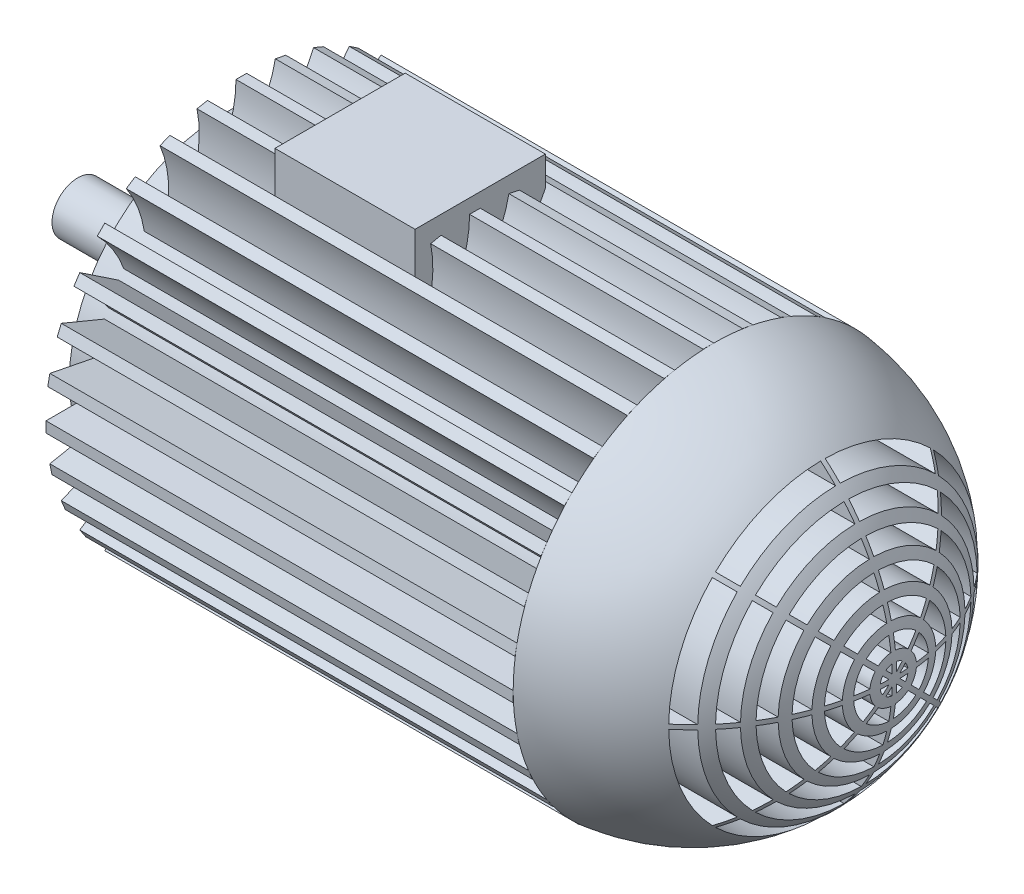
from build123d import *
from build123d.topology import SkipClean

# Parameters (mm, degrees)
BOSS_EXTRUDE1_DEPTH = 200
CIRPATTERN1_COUNT   = 32
BOSS_EXTRUDE2_START = 10
SKETCH3_R           = 65.881435925
BOSS_EXTRUDE2_DEPTH = 10
SKETCH4_R           = 11
BOSS_EXTRUDE3_DEPTH = 30
SKETCH5_R           = 5
CUT_EXTRUDE1_DEPTH  = 5
CIRPATTERN2_COUNT   = 8
SKETCH6_R           = 4
CUT_EXTRUDE2_DEPTH  = 240
SKETCH7_W           = 55.76744746
SKETCH7_H           = 35.817691574
BOSS_EXTRUDE4_DEPTH = 60
CUT_EXTRUDE6_DEPTH  = 80
SCALE1_SCALE        = 0.8
SKETCH12_R          = 8.8
SKETCH12_R_2        = 3.2
BOSS_EXTRUDE7_DEPTH = 25.84


with BuildPart() as part:
    # Sketch1 → Revolve1 (revolve)
    with BuildSketch(Plane.XY):
        with BuildLine():
            Line((0, 0), (277.354361283, 0))
            ThreePointArc((277.354361283, 0), (255.164754533, 57.791258522), (200, 85.881435925))
            Line((200, 85.881435925), (200, 65.881435925))
            Line((200, 65.881435925), (0, 65.881435925))
            Line((0, 65.881435925), (0, 0))
        make_face()
    revolve(axis=Axis((0, 0, 0), (1, 0, 0)))

    # Sketch2 → Boss-Extrude1 (add)
    with BuildSketch(Plane.ZY):
        with BuildLine():
            Line((0, 85.881435925), (0, 65.881435925))
            ThreePointArc((0, 65.881435925), (4.544830399, 65.724486428), (9.068006478, 65.254385738))
            ThreePointArc((9.068006478, 65.254385738), (5.694165901, 75.32361746), (4.551932571, 85.881435925))
            Line((4.551932571, 85.881435925), (0, 85.881435925))
        make_face()
    boss_extrude1 = extrude(amount=-BOSS_EXTRUDE1_DEPTH)

    # CirPattern1: Boss-Extrude1 ×32 about axis
    cirpattern1_axis = Axis((0, 0, 0), (1, 0, 0))
    for i in range(1, CIRPATTERN1_COUNT):
        add(boss_extrude1.rotate(cirpattern1_axis, i * 360 / CIRPATTERN1_COUNT))

    # Sketch3 → Boss-Extrude2 (add)
    with SkipClean():  # the faces are left unmerged after this step: merging them gives an invalid solid
        with BuildSketch(Plane.ZY.offset(BOSS_EXTRUDE2_START)):
            Circle(SKETCH3_R)
        extrude(amount=-BOSS_EXTRUDE2_DEPTH)

    # Sketch4 → Boss-Extrude3 (add)
    with SkipClean():  # the faces are left unmerged after this step: merging them gives an invalid solid
        with BuildSketch(Plane.ZY.offset(10)):
            Circle(SKETCH4_R)
        extrude(amount=BOSS_EXTRUDE3_DEPTH)

    # Sketch5 → Cut-Extrude1 (cut)
    with SkipClean():  # the faces are left unmerged after this step: merging them gives an invalid solid
        with BuildSketch(Plane.ZY.offset(10)):
            with Locations((0, 51.186527866)):
                Circle(SKETCH5_R)
        cut_extrude1 = extrude(amount=-CUT_EXTRUDE1_DEPTH, mode=Mode.SUBTRACT)

    # CirPattern2: Cut-Extrude1 ×8 about axis
    with SkipClean():  # the faces are left unmerged after this step: merging them gives an invalid solid
        cirpattern2_axis = Axis((0, 0, 0), (1, 0, 0))
        for i in range(1, CIRPATTERN2_COUNT):
            add(cut_extrude1.rotate(cirpattern2_axis, i * 360 / CIRPATTERN2_COUNT), mode=Mode.SUBTRACT)

    # Sketch6 → Cut-Extrude2 (cut)
    with SkipClean():  # the faces are left unmerged after this step: merging them gives an invalid solid
        with BuildSketch(Plane.ZY.offset(40)):
            Circle(SKETCH6_R)
        extrude(amount=-CUT_EXTRUDE2_DEPTH, mode=Mode.SUBTRACT)

    # Sketch7 → Boss-Extrude4 (add)
    with SkipClean():  # the faces are left unmerged after this step: merging them gives an invalid solid
        with BuildSketch(Plane.ZY.offset(-40)):
            with Locations((0, 74.102092784)):
                Rectangle(SKETCH7_W, SKETCH7_H)
        extrude(amount=-BOSS_EXTRUDE4_DEPTH)

    # Sketch11 → Cut-Extrude6 (cut)
    with SkipClean():  # the faces are left unmerged after this step: merging them gives an invalid solid
        with BuildSketch(Plane.ZY.offset(-280)):
            with BuildLine():
                ThreePointArc((-0.962940488, 65.992974972), (-25.257106536, 60.976049146), (-45.983178364, 47.344981862))
                Line((-45.983178364, 47.344981862), (-41.740040872, 43.101844369))
                ThreePointArc((-41.740040872, 43.101844369), (-22.961005942, 55.432771951), (-0.962940488, 59.992272383))
                Line((-0.962940488, 59.992272383), (-0.962940488, 65.992974972))
            make_face()
            with BuildLine():
                ThreePointArc((-47.344981862, 45.983178364), (-60.976049146, 25.257106536), (-65.992974972, 0.962940488))
                Line((-65.992974972, 0.962940488), (-59.992272383, 0.962940488))
                ThreePointArc((-59.992272383, 0.962940488), (-55.432771951, 22.961005942), (-43.101844369, 41.740040872))
                Line((-43.101844369, 41.740040872), (-47.344981862, 45.983178364))
            make_face()
            with BuildLine():
                ThreePointArc((-65.992974972, -0.962940488), (-60.976049146, -25.257106536), (-47.344981862, -45.983178364))
                Line((-47.344981862, -45.983178364), (-43.101844369, -41.740040872))
                ThreePointArc((-43.101844369, -41.740040872), (-55.432771951, -22.961005942), (-59.992272383, -0.962940488))
                Line((-59.992272383, -0.962940488), (-65.992974972, -0.962940488))
            make_face()
            with BuildLine():
                ThreePointArc((-55.991720331, -0.962940488), (-51.737253821, -21.430272212), (-40.273026885, -38.911223387))
                Line((-40.273026885, -38.911223387), (-36.029683521, -34.667880024))
                ThreePointArc((-36.029683521, -34.667880024), (-46.193976626, -19.134171618), (-49.990726596, -0.962940488))
                Line((-49.990726596, -0.962940488), (-55.991720331, -0.962940488))
            make_face()
            with BuildLine():
                ThreePointArc((-45.989920044, -0.962940488), (-42.498458496, -17.603437889), (-33.200686078, -31.83888258))
                Line((-33.200686078, -31.83888258), (-28.95697596, -27.595172463))
                ThreePointArc((-28.95697596, -27.595172463), (-36.9551813, -15.307337295), (-39.98840764, -0.962940488))
                Line((-39.98840764, -0.962940488), (-45.989920044, -0.962940488))
            make_face()
            with BuildLine():
                ThreePointArc((-35.987119163, -0.962940488), (-33.25966317, -13.776603565), (-26.127637744, -24.765834246))
                Line((-26.127637744, -24.765834246), (-21.883174571, -20.521371073))
                ThreePointArc((-21.883174571, -20.521371073), (-27.716385975, -11.480502971), (-29.984541778, -0.962940488))
                Line((-29.984541778, -0.962940488), (-35.987119163, -0.962940488))
            make_face()
            with BuildLine():
                ThreePointArc((-25.982162066, -0.962940488), (-24.020867845, -9.949769241), (-19.053064735, -17.691261238))
                Line((-19.053064735, -17.691261238), (-14.806636165, -13.444832668))
                ThreePointArc((-14.806636165, -13.444832668), (-18.47759065, -7.653668647), (-19.97680519, -0.962940488))
                Line((-19.97680519, -0.962940488), (-25.982162066, -0.962940488))
            make_face()
            with BuildLine():
                ThreePointArc((-15.970997014, -0.962940488), (-14.78207252, -6.122934918), (-11.97410204, -10.612298542))
                Line((-11.97410204, -10.612298542), (-7.719109817, -6.357306319))
                ThreePointArc((-7.719109817, -6.357306319), (-9.238795325, -3.826834324), (-9.953529305, -0.962940488))
                Line((-9.953529305, -0.962940488), (-15.970997014, -0.962940488))
            make_face()
            with BuildLine():
                ThreePointArc((-5.922224719, -0.962940488), (-5.543277195, -2.296100594), (-4.868547007, -3.506743509))
                Line((-4.868547007, -3.506743509), (-2.324743985, -0.962940488))
                Line((-2.324743985, -0.962940488), (-5.922224719, -0.962940488))
            make_face()
            with BuildLine():
                ThreePointArc((-4.868547007, 3.506743509), (-5.543277195, 2.296100594), (-5.922224719, 0.962940488))
                Line((-5.922224719, 0.962940488), (-2.324743985, 0.962940488))
                Line((-2.324743985, 0.962940488), (-4.868547007, 3.506743509))
            make_face()
            with BuildLine():
                ThreePointArc((-0.962940488, 5.922224719), (-2.296100594, 5.543277195), (-3.506743509, 4.868547007))
                Line((-3.506743509, 4.868547007), (-0.962940488, 2.324743985))
                Line((-0.962940488, 2.324743985), (-0.962940488, 5.922224719))
            make_face()
            with BuildLine():
                ThreePointArc((3.506743509, 4.868547007), (2.296100594, 5.543277195), (0.962940488, 5.922224719))
                Line((0.962940488, 5.922224719), (0.962940488, 2.324743985))
                Line((0.962940488, 2.324743985), (3.506743509, 4.868547007))
            make_face()
            with BuildLine():
                ThreePointArc((5.922224719, 0.962940488), (5.543277195, 2.296100594), (4.868547007, 3.506743509))
                Line((4.868547007, 3.506743509), (2.324743985, 0.962940488))
                Line((2.324743985, 0.962940488), (5.922224719, 0.962940488))
            make_face()
            with BuildLine():
                Line((2.324743985, -0.962940488), (4.868547007, -3.506743509))
                ThreePointArc((4.868547007, -3.506743509), (5.543277195, -2.296100594), (5.922224719, -0.962940488))
                Line((5.922224719, -0.962940488), (2.324743985, -0.962940488))
            make_face()
            with BuildLine():
                Line((0.962940488, -2.324743985), (0.962940488, -5.922224719))
                ThreePointArc((0.962940488, -5.922224719), (2.296100594, -5.543277195), (3.506743509, -4.868547007))
                Line((3.506743509, -4.868547007), (0.962940488, -2.324743985))
            make_face()
            with BuildLine():
                Line((-0.962940488, -2.324743985), (-3.506743509, -4.868547007))
                ThreePointArc((-3.506743509, -4.868547007), (-2.296100594, -5.543277195), (-0.962940488, -5.922224719))
                Line((-0.962940488, -5.922224719), (-0.962940488, -2.324743985))
            make_face()
            with BuildLine():
                Line((7.719109817, -6.357306319), (11.97410204, -10.612298542))
                ThreePointArc((11.97410204, -10.612298542), (14.78207252, -6.122934918), (15.970997014, -0.962940488))
                Line((15.970997014, -0.962940488), (9.953529305, -0.962940488))
                ThreePointArc((9.953529305, -0.962940488), (9.238795325, -3.826834324), (7.719109817, -6.357306319))
            make_face()
            with BuildLine():
                ThreePointArc((15.970997014, 0.962940488), (14.78207252, 6.122934918), (11.97410204, 10.612298542))
                Line((11.97410204, 10.612298542), (7.719109817, 6.357306319))
                ThreePointArc((7.719109817, 6.357306319), (9.238795325, 3.826834324), (9.953529305, 0.962940488))
                Line((9.953529305, 0.962940488), (15.970997014, 0.962940488))
            make_face()
            with BuildLine():
                ThreePointArc((10.612298542, 11.97410204), (6.122934918, 14.78207252), (0.962940488, 15.970997014))
                Line((0.962940488, 15.970997014), (0.962940488, 9.953529305))
                ThreePointArc((0.962940488, 9.953529305), (3.826834324, 9.238795325), (6.357306319, 7.719109817))
                Line((6.357306319, 7.719109817), (10.612298542, 11.97410204))
            make_face()
            with BuildLine():
                ThreePointArc((-0.962940488, 15.970997014), (-6.122934918, 14.78207252), (-10.612298542, 11.97410204))
                Line((-10.612298542, 11.97410204), (-6.357306319, 7.719109817))
                ThreePointArc((-6.357306319, 7.719109817), (-3.826834324, 9.238795325), (-0.962940488, 9.953529305))
                Line((-0.962940488, 9.953529305), (-0.962940488, 15.970997014))
            make_face()
            with BuildLine():
                ThreePointArc((-11.97410204, 10.612298542), (-14.78207252, 6.122934918), (-15.970997014, 0.962940488))
                Line((-15.970997014, 0.962940488), (-9.953529305, 0.962940488))
                ThreePointArc((-9.953529305, 0.962940488), (-9.238795325, 3.826834324), (-7.719109817, 6.357306319))
                Line((-7.719109817, 6.357306319), (-11.97410204, 10.612298542))
            make_face()
            with BuildLine():
                Line((-6.357306319, -7.719109817), (-10.612298542, -11.97410204))
                ThreePointArc((-10.612298542, -11.97410204), (-6.122934918, -14.78207252), (-0.962940488, -15.970997014))
                Line((-0.962940488, -15.970997014), (-0.962940488, -9.953529305))
                ThreePointArc((-0.962940488, -9.953529305), (-3.826834324, -9.238795325), (-6.357306319, -7.719109817))
            make_face()
            with BuildLine():
                Line((0.962940488, -9.953529305), (0.962940488, -15.970997014))
                ThreePointArc((0.962940488, -15.970997014), (6.122934918, -14.78207252), (10.612298542, -11.97410204))
                Line((10.612298542, -11.97410204), (6.357306319, -7.719109817))
                ThreePointArc((6.357306319, -7.719109817), (3.826834324, -9.238795325), (0.962940488, -9.953529305))
            make_face()
            with BuildLine():
                ThreePointArc((-19.053064735, 17.691261238), (-24.020867845, 9.949769241), (-25.982162066, 0.962940488))
                Line((-25.982162066, 0.962940488), (-19.97680519, 0.962940488))
                ThreePointArc((-19.97680519, 0.962940488), (-18.47759065, 7.653668647), (-14.806636165, 13.444832668))
                Line((-14.806636165, 13.444832668), (-19.053064735, 17.691261238))
            make_face()
            with BuildLine():
                Line((-13.444832668, -14.806636165), (-17.691261238, -19.053064735))
                ThreePointArc((-17.691261238, -19.053064735), (-9.949769241, -24.020867845), (-0.962940488, -25.982162066))
                Line((-0.962940488, -25.982162066), (-0.962940488, -19.97680519))
                ThreePointArc((-0.962940488, -19.97680519), (-7.653668647, -18.47759065), (-13.444832668, -14.806636165))
            make_face()
            with BuildLine():
                Line((0.962940488, -19.97680519), (0.962940488, -25.982162066))
                ThreePointArc((0.962940488, -25.982162066), (9.949769241, -24.020867845), (17.691261238, -19.053064735))
                Line((17.691261238, -19.053064735), (13.444832668, -14.806636165))
                ThreePointArc((13.444832668, -14.806636165), (7.653668647, -18.47759065), (0.962940488, -19.97680519))
            make_face()
            with BuildLine():
                Line((14.806636165, -13.444832668), (19.053064735, -17.691261238))
                ThreePointArc((19.053064735, -17.691261238), (24.020867845, -9.949769241), (25.982162066, -0.962940488))
                Line((25.982162066, -0.962940488), (19.97680519, -0.962940488))
                ThreePointArc((19.97680519, -0.962940488), (18.47759065, -7.653668647), (14.806636165, -13.444832668))
            make_face()
            with BuildLine():
                ThreePointArc((25.982162066, 0.962940488), (24.020867845, 9.949769241), (19.053064735, 17.691261238))
                Line((19.053064735, 17.691261238), (14.806636165, 13.444832668))
                ThreePointArc((14.806636165, 13.444832668), (18.47759065, 7.653668647), (19.97680519, 0.962940488))
                Line((19.97680519, 0.962940488), (25.982162066, 0.962940488))
            make_face()
            with BuildLine():
                ThreePointArc((17.691261238, 19.053064735), (9.949769241, 24.020867845), (0.962940488, 25.982162066))
                Line((0.962940488, 25.982162066), (0.962940488, 19.97680519))
                ThreePointArc((0.962940488, 19.97680519), (7.653668647, 18.47759065), (13.444832668, 14.806636165))
                Line((13.444832668, 14.806636165), (17.691261238, 19.053064735))
            make_face()
            with BuildLine():
                ThreePointArc((-0.962940488, 25.982162066), (-9.949769241, 24.020867845), (-17.691261238, 19.053064735))
                Line((-17.691261238, 19.053064735), (-13.444832668, 14.806636165))
                ThreePointArc((-13.444832668, 14.806636165), (-7.653668647, 18.47759065), (-0.962940488, 19.97680519))
                Line((-0.962940488, 19.97680519), (-0.962940488, 25.982162066))
            make_face()
            with BuildLine():
                ThreePointArc((-26.127637744, 24.765834246), (-33.25966317, 13.776603565), (-35.987119163, 0.962940488))
                Line((-35.987119163, 0.962940488), (-29.984541778, 0.962940488))
                ThreePointArc((-29.984541778, 0.962940488), (-27.716385975, 11.480502971), (-21.883174571, 20.521371073))
                Line((-21.883174571, 20.521371073), (-26.127637744, 24.765834246))
            make_face()
            with BuildLine():
                ThreePointArc((-0.962940488, 35.987119163), (-13.776603565, 33.25966317), (-24.765834246, 26.127637744))
                Line((-24.765834246, 26.127637744), (-20.521371073, 21.883174571))
                ThreePointArc((-20.521371073, 21.883174571), (-11.480502971, 27.716385975), (-0.962940488, 29.984541778))
                Line((-0.962940488, 29.984541778), (-0.962940488, 35.987119163))
            make_face()
            with BuildLine():
                ThreePointArc((35.987119163, 0.962940488), (33.25966317, 13.776603565), (26.127637744, 24.765834246))
                Line((26.127637744, 24.765834246), (21.883174571, 20.521371073))
                ThreePointArc((21.883174571, 20.521371073), (27.716385975, 11.480502971), (29.984541778, 0.962940488))
                Line((29.984541778, 0.962940488), (35.987119163, 0.962940488))
            make_face()
            with BuildLine():
                ThreePointArc((45.989920044, 0.962940488), (42.498458496, 17.603437889), (33.200686078, 31.83888258))
                Line((33.200686078, 31.83888258), (28.95697596, 27.595172463))
                ThreePointArc((28.95697596, 27.595172463), (36.9551813, 15.307337295), (39.98840764, 0.962940488))
                Line((39.98840764, 0.962940488), (45.989920044, 0.962940488))
            make_face()
            with BuildLine():
                ThreePointArc((55.991720331, 0.962940488), (51.737253821, 21.430272212), (40.273026885, 38.911223387))
                Line((40.273026885, 38.911223387), (36.029683521, 34.667880024))
                ThreePointArc((36.029683521, 34.667880024), (46.193976626, 19.134171618), (49.990726596, 0.962940488))
                Line((49.990726596, 0.962940488), (55.991720331, 0.962940488))
            make_face()
            with BuildLine():
                ThreePointArc((65.992974972, 0.962940488), (60.976049146, 25.257106536), (47.344981862, 45.983178364))
                Line((47.344981862, 45.983178364), (43.101844369, 41.740040872))
                ThreePointArc((43.101844369, 41.740040872), (55.432771951, 22.961005942), (59.992272383, 0.962940488))
                Line((59.992272383, 0.962940488), (65.992974972, 0.962940488))
            make_face()
            with BuildLine():
                Line((43.101844369, -41.740040872), (47.344981862, -45.983178364))
                ThreePointArc((47.344981862, -45.983178364), (60.976049146, -25.257106536), (65.992974972, -0.962940488))
                Line((65.992974972, -0.962940488), (59.992272383, -0.962940488))
                ThreePointArc((59.992272383, -0.962940488), (55.432771951, -22.961005942), (43.101844369, -41.740040872))
            make_face()
            with BuildLine():
                Line((36.029683521, -34.667880024), (40.273026885, -38.911223387))
                ThreePointArc((40.273026885, -38.911223387), (51.737253821, -21.430272212), (55.991720331, -0.962940488))
                Line((55.991720331, -0.962940488), (49.990726596, -0.962940488))
                ThreePointArc((49.990726596, -0.962940488), (46.193976626, -19.134171618), (36.029683521, -34.667880024))
            make_face()
            with BuildLine():
                Line((28.95697596, -27.595172463), (33.200686078, -31.83888258))
                ThreePointArc((33.200686078, -31.83888258), (42.498458496, -17.603437889), (45.989920044, -0.962940488))
                Line((45.989920044, -0.962940488), (39.98840764, -0.962940488))
                ThreePointArc((39.98840764, -0.962940488), (36.9551813, -15.307337295), (28.95697596, -27.595172463))
            make_face()
            with BuildLine():
                Line((21.883174571, -20.521371073), (26.127637744, -24.765834246))
                ThreePointArc((26.127637744, -24.765834246), (33.25966317, -13.776603565), (35.987119163, -0.962940488))
                Line((35.987119163, -0.962940488), (29.984541778, -0.962940488))
                ThreePointArc((29.984541778, -0.962940488), (27.716385975, -11.480502971), (21.883174571, -20.521371073))
            make_face()
            with BuildLine():
                Line((0.962940488, -59.992272383), (0.962940488, -65.992974972))
                ThreePointArc((0.962940488, -65.992974972), (25.257106536, -60.976049146), (45.983178364, -47.344981862))
                Line((45.983178364, -47.344981862), (41.740040872, -43.101844369))
                ThreePointArc((41.740040872, -43.101844369), (22.961005942, -55.432771951), (0.962940488, -59.992272383))
            make_face()
            with BuildLine():
                Line((0.962940488, -49.990726596), (0.962940488, -55.991720331))
                ThreePointArc((0.962940488, -55.991720331), (21.430272212, -51.737253821), (38.911223387, -40.273026885))
                Line((38.911223387, -40.273026885), (34.667880024, -36.029683521))
                ThreePointArc((34.667880024, -36.029683521), (19.134171618, -46.193976626), (0.962940488, -49.990726596))
            make_face()
            with BuildLine():
                Line((0.962940488, -39.98840764), (0.962940488, -45.989920044))
                ThreePointArc((0.962940488, -45.989920044), (17.603437889, -42.498458496), (31.83888258, -33.200686078))
                Line((31.83888258, -33.200686078), (27.595172463, -28.95697596))
                ThreePointArc((27.595172463, -28.95697596), (15.307337295, -36.9551813), (0.962940488, -39.98840764))
            make_face()
            with BuildLine():
                Line((0.962940488, -29.984541778), (0.962940488, -35.987119163))
                ThreePointArc((0.962940488, -35.987119163), (13.776603565, -33.25966317), (24.765834246, -26.127637744))
                Line((24.765834246, -26.127637744), (20.521371073, -21.883174571))
                ThreePointArc((20.521371073, -21.883174571), (11.480502971, -27.716385975), (0.962940488, -29.984541778))
            make_face()
            with BuildLine():
                Line((-20.521371073, -21.883174571), (-24.765834246, -26.127637744))
                ThreePointArc((-24.765834246, -26.127637744), (-13.776603565, -33.25966317), (-0.962940488, -35.987119163))
                Line((-0.962940488, -35.987119163), (-0.962940488, -29.984541778))
                ThreePointArc((-0.962940488, -29.984541778), (-11.480502971, -27.716385975), (-20.521371073, -21.883174571))
            make_face()
            with BuildLine():
                Line((-27.595172463, -28.95697596), (-31.83888258, -33.200686078))
                ThreePointArc((-31.83888258, -33.200686078), (-17.603437889, -42.498458496), (-0.962940488, -45.989920044))
                Line((-0.962940488, -45.989920044), (-0.962940488, -39.98840764))
                ThreePointArc((-0.962940488, -39.98840764), (-15.307337295, -36.9551813), (-27.595172463, -28.95697596))
            make_face()
            with BuildLine():
                Line((-34.667880024, -36.029683521), (-38.911223387, -40.273026885))
                ThreePointArc((-38.911223387, -40.273026885), (-21.430272212, -51.737253821), (-0.962940488, -55.991720331))
                Line((-0.962940488, -55.991720331), (-0.962940488, -49.990726596))
                ThreePointArc((-0.962940488, -49.990726596), (-19.134171618, -46.193976626), (-34.667880024, -36.029683521))
            make_face()
            with BuildLine():
                Line((-41.740040872, -43.101844369), (-45.983178364, -47.344981862))
                ThreePointArc((-45.983178364, -47.344981862), (-25.257106536, -60.976049146), (-0.962940488, -65.992974972))
                Line((-0.962940488, -65.992974972), (-0.962940488, -59.992272383))
                ThreePointArc((-0.962940488, -59.992272383), (-22.961005942, -55.432771951), (-41.740040872, -43.101844369))
            make_face()
            with BuildLine():
                ThreePointArc((45.983178364, 47.344981862), (25.257106536, 60.976049146), (0.962940488, 65.992974972))
                Line((0.962940488, 65.992974972), (0.962940488, 59.992272383))
                ThreePointArc((0.962940488, 59.992272383), (22.961005942, 55.432771951), (41.740040872, 43.101844369))
                Line((41.740040872, 43.101844369), (45.983178364, 47.344981862))
            make_face()
            with BuildLine():
                ThreePointArc((38.911223387, 40.273026885), (21.430272212, 51.737253821), (0.962940488, 55.991720331))
                Line((0.962940488, 55.991720331), (0.962940488, 49.990726596))
                ThreePointArc((0.962940488, 49.990726596), (19.134171618, 46.193976626), (34.667880024, 36.029683521))
                Line((34.667880024, 36.029683521), (38.911223387, 40.273026885))
            make_face()
            with BuildLine():
                ThreePointArc((31.83888258, 33.200686078), (17.603437889, 42.498458496), (0.962940488, 45.989920044))
                Line((0.962940488, 45.989920044), (0.962940488, 39.98840764))
                ThreePointArc((0.962940488, 39.98840764), (15.307337295, 36.9551813), (27.595172463, 28.95697596))
                Line((27.595172463, 28.95697596), (31.83888258, 33.200686078))
            make_face()
            with BuildLine():
                ThreePointArc((24.765834246, 26.127637744), (13.776603565, 33.25966317), (0.962940488, 35.987119163))
                Line((0.962940488, 35.987119163), (0.962940488, 29.984541778))
                ThreePointArc((0.962940488, 29.984541778), (11.480502971, 27.716385975), (20.521371073, 21.883174571))
                Line((20.521371073, 21.883174571), (24.765834246, 26.127637744))
            make_face()
            with BuildLine():
                ThreePointArc((-0.962940488, 55.991720331), (-21.430272212, 51.737253821), (-38.911223387, 40.273026885))
                Line((-38.911223387, 40.273026885), (-34.667880024, 36.029683521))
                ThreePointArc((-34.667880024, 36.029683521), (-19.134171618, 46.193976626), (-0.962940488, 49.990726596))
                Line((-0.962940488, 49.990726596), (-0.962940488, 55.991720331))
            make_face()
            with BuildLine():
                ThreePointArc((-0.962940488, 45.989920044), (-17.603437889, 42.498458496), (-31.83888258, 33.200686078))
                Line((-31.83888258, 33.200686078), (-27.595172463, 28.95697596))
                ThreePointArc((-27.595172463, 28.95697596), (-15.307337295, 36.9551813), (-0.962940488, 39.98840764))
                Line((-0.962940488, 39.98840764), (-0.962940488, 45.989920044))
            make_face()
            with BuildLine():
                ThreePointArc((-33.200686078, 31.83888258), (-42.498458496, 17.603437889), (-45.989920044, 0.962940488))
                Line((-45.989920044, 0.962940488), (-39.98840764, 0.962940488))
                ThreePointArc((-39.98840764, 0.962940488), (-36.9551813, 15.307337295), (-28.95697596, 27.595172463))
                Line((-28.95697596, 27.595172463), (-33.200686078, 31.83888258))
            make_face()
            with BuildLine():
                ThreePointArc((-40.273026885, 38.911223387), (-51.737253821, 21.430272212), (-55.991720331, 0.962940488))
                Line((-55.991720331, 0.962940488), (-49.990726596, 0.962940488))
                ThreePointArc((-49.990726596, 0.962940488), (-46.193976626, 19.134171618), (-36.029683521, 34.667880024))
                Line((-36.029683521, 34.667880024), (-40.273026885, 38.911223387))
            make_face()
        extrude(amount=CUT_EXTRUDE6_DEPTH, mode=Mode.SUBTRACT)


with BuildPart() as part_1:
    # Scale1: scaled about (114.628210563, 1.233399455, 0.00933198)
    add(part.part.scale(SCALE1_SCALE).moved(Location((22.925642113, 0.246679891, 0.001866396))))

    # Sketch12 → Boss-Extrude7 (add)
    with BuildSketch(Plane.ZY.offset(9.074357887)):
        with Locations((0.001866396, 0.246679891)):
            Circle(SKETCH12_R)
        with Locations((0.001866396, 0.246679891)):
            Circle(SKETCH12_R_2, mode=Mode.SUBTRACT)
    extrude(amount=BOSS_EXTRUDE7_DEPTH)


solid = part_1.part
